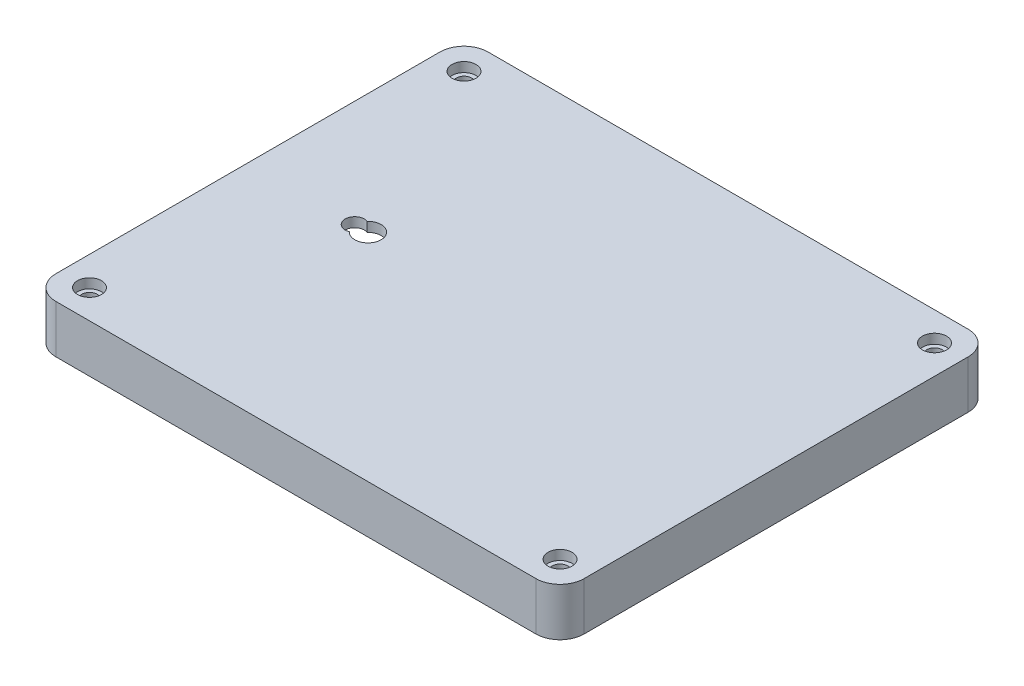
from build123d import *

# Parameters (mm, degrees)
SKETCH1_W            = 110
SKETCH1_H            = 90
BOSS_EXTRUDE1_DEPTH  = 10
SHELL2_T             = -2
FILLET3_R            = 5
FILLET4_R            = 5
SKETCH5_R            = 4
BOSS_EXTRUDE12_DEPTH = 8
FILLET5_R            = 5
FILLET6_DEPTH        = 9
FILLET7_R            = 5
FILLET8_R            = 5
FILLET9_R            = 5
FILLET10_R           = 5
FILLET11_DEPTH       = 9
FILLET12_DEPTH       = 9
SKETCH6_R            = 1.6
CUT_EXTRUDE1_DEPTH   = 10
SKETCH7_R            = 4
BOSS_EXTRUDE13_DEPTH = 10
SKETCH8_R            = 1.5
CUT_EXTRUDE2_DEPTH   = 8
SKETCH9_R            = 2.75
CUT_EXTRUDE3_DEPTH   = 10
SKETCH10_R           = 2
CUT_EXTRUDE7_DEPTH   = 10
SKETCH11_R           = 2.5
CUT_EXTRUDE8_DEPTH   = 2


with BuildPart() as part:
    # Sketch1 → Boss-Extrude1 (new body)
    with BuildSketch(Plane(origin=(0, 0, 0), x_dir=(1, 0, 0), z_dir=(0, 1, 0))):
        with Locations((55, 45)):
            Rectangle(SKETCH1_W, SKETCH1_H)
    extrude(amount=BOSS_EXTRUDE1_DEPTH)

    # Shell2
    shell2_openings = [part.faces().sort_by_distance(p)[0] for p in [
        (55, 0, -45),
    ]]
    offset(amount=SHELL2_T, openings=shell2_openings, kind=Kind.INTERSECTION)

    # Fillet3
    fillet3_edges = [part.edges().sort_by_distance(p)[0] for p in [
        (0, 5, -90),
        (110, 5, -90),
        (110, 5, 0),
        (0, 5, 0),
    ]]
    fillet(fillet3_edges, radius=FILLET3_R)

    # Fillet4
    fillet4_edges = [part.edges().sort_by_distance(p)[0] for p in [
        (2, 4, -88),
        (2, 4, -2),
        (108, 4, -2),
        (108, 4, -88),
    ]]
    fillet(fillet4_edges, radius=FILLET4_R)

    # Sketch5 → Boss-Extrude12 (add)
    with BuildSketch(Plane(origin=(0, 8, 0), x_dir=(-1, 0, 0), z_dir=(0, -1, 0))):
        with Locations((-104, 6)):
            Circle(SKETCH5_R)
        with Locations((-104, 84)):
            Circle(SKETCH5_R)
        with Locations((-6, 84)):
            Circle(SKETCH5_R)
        with Locations((-6, 6)):
            Circle(SKETCH5_R)
    extrude(amount=BOSS_EXTRUDE12_DEPTH)

    # Fillet5
    # the kernel refuses this fillet: 5 mm, written as the material it adds along each edge
    with BuildSketch(Plane(origin=(107.972048604, 0, -6.472048604), x_dir=(-0.7834590295976485, 0, -0.621443439857491), z_dir=(0, 1, 0))) as fillet5_piece_1_section:
        with BuildLine():
            CenterArc((9.160403969, -3.547792862), FILLET5_R, 134.800989095, 83.620629792)
            Line((5.243108821, -6.655010061), (4.851379306, -6.965731781))
            ThreePointArc((4.851379306, -6.965731781), (-0.085536357, -0.74172022), (-0.422348831, -0.26762187))
            Line((-0.422348831, -0.26762187), (0.35232323, 0.354779286))
            ThreePointArc((0.35232323, 0.354779286), (2.818585837, -0.661765711), (5.284848444, 0.354779286))
            Line((5.284848444, 0.354779286), (5.637171673, 0))
        make_face()
    fillet5_piece_1 = extrude(amount=29.180673535, mode=Mode.PRIVATE)
    fillet5_piece_1 = split(fillet5_piece_1, bisect_by=Plane(origin=(107.972048604, 10, -6.472048604), z_dir=(0, -1, 0)), keep=Keep.TOP, mode=Mode.PRIVATE)
    add(fillet5_piece_1)

    # Fillet6: read off the stored shape, not the designer's step
    # Fillet6 outline → Fillet6 (add)
    with BuildSketch(Plane(origin=(0, 0, 0), x_dir=(1, 0, 0), z_dir=(0, 1, 0))):
        with BuildLine():
            ThreePointArc((100.02476804, 6.444444444), (98.389061423, 3.273220038), (95.05572809, 2))
            Line((95.05572809, 2), (103, 2))
            ThreePointArc((103, 2), (103.264345398, 2.006992739), (103.527951396, 2.027951396))
            ThreePointArc((103.527951396, 2.027951396), (100.866163882, 3.51422624), (100.02476804, 6.444444444))
        make_face()
    extrude(amount=FILLET6_DEPTH)

    # Fillet7
    # the kernel refuses this fillet: 5 mm, written as the material it adds along each edge
    with BuildSketch(Plane(origin=(107.972048604, 0, -83.527951396), x_dir=(0.0032991627515109216, 0, 0.9999945577477605), z_dir=(0, 1, 0))) as fillet7_piece_1_section:
        with BuildLine():
            CenterArc((8.4557736, -4.999972789), FILLET7_R, 89.810971555, 83.620629792)
            Line((3.488593561, -4.428026585), (2.991875557, -4.370831965))
            ThreePointArc((2.991875557, -4.370831965), (2.264117061, -1.804476076), (-0.060643809, -0.496308703))
            Line((-0.060643809, -0.496308703), (-0.051154492, 0.497376334))
            ThreePointArc((-0.051154492, 0.497376334), (0.52969032, 0.526206725), (8.473918995, 0.499997279))
            Line((8.473918995, 0.499997279), (8.472269414, 0))
        make_face()
    fillet7_piece_1 = extrude(amount=29.180673535, mode=Mode.PRIVATE)
    fillet7_piece_1 = split(fillet7_piece_1, bisect_by=Plane(origin=(107.972048604, 10, -83.527951396), z_dir=(0, -1, 0)), keep=Keep.TOP, mode=Mode.PRIVATE)
    add(fillet7_piece_1)

    # Fillet8
    # the kernel refuses this fillet: 5 mm, written as the material it adds along each edge
    with BuildSketch(Plane(origin=(103.527951396, 0, -87.972048604), x_dir=(-0.6214434398574978, 0, 0.783459029597643), z_dir=(0, 1, 0))) as fillet8_piece_1_section:
        with BuildLine():
            CenterArc((9.160403969, -3.547792862), FILLET8_R, 134.800989095, 83.620629792)
            Line((5.243108821, -6.655010061), (4.851379306, -6.965731781))
            ThreePointArc((4.851379306, -6.965731781), (-0.085536357, -0.74172022), (-0.422348831, -0.26762187))
            Line((-0.422348831, -0.26762187), (0.35232323, 0.354779286))
            ThreePointArc((0.35232323, 0.354779286), (2.818585837, -0.661765711), (5.284848444, 0.354779286))
            Line((5.284848444, 0.354779286), (5.637171673, 0))
        make_face()
    fillet8_piece_1 = extrude(amount=29.180673535, mode=Mode.PRIVATE)
    fillet8_piece_1 = split(fillet8_piece_1, bisect_by=Plane(origin=(103.527951396, 10, -87.972048604), z_dir=(0, -1, 0)), keep=Keep.TOP, mode=Mode.PRIVATE)
    add(fillet8_piece_1)

    # Fillet9
    # the kernel refuses this fillet: 5 mm, written as the material it adds along each edge
    with BuildSketch(Plane(origin=(6.472048604, 29.180673535, -2.027951396), x_dir=(0.9999945577477605, 0, 0.003299162751511756), z_dir=(0, -1, 0))) as fillet9_piece_1_section:
        with BuildLine():
            CenterArc((8.4557736, -4.999972789), FILLET9_R, 89.810971555, 83.620629792)
            Line((3.488593561, -4.428026585), (2.991875557, -4.370831965))
            ThreePointArc((2.991875557, -4.370831965), (2.264117061, -1.804476076), (-0.060643809, -0.496308703))
            Line((-0.060643809, -0.496308703), (-0.051154492, 0.497376334))
            ThreePointArc((-0.051154492, 0.497376334), (0.52969032, 0.526206725), (8.473918995, 0.499997279))
            Line((8.473918995, 0.499997279), (8.472269414, 0))
        make_face()
    fillet9_piece_1 = extrude(amount=29.180673535, mode=Mode.PRIVATE)
    fillet9_piece_1 = split(fillet9_piece_1, bisect_by=Plane(origin=(6.472048604, 10, -2.027951396), z_dir=(0, -1, 0)), keep=Keep.TOP, mode=Mode.PRIVATE)
    add(fillet9_piece_1)

    # Fillet10
    # the kernel refuses this fillet: 5 mm, written as the material it adds along each edge
    with BuildSketch(Plane(origin=(2.027951396, 29.180673535, -6.472048604), x_dir=(0.783459029597646, 0, -0.6214434398574942), z_dir=(0, -1, 0))) as fillet10_piece_1_section:
        with BuildLine():
            CenterArc((9.160403969, -3.547792862), FILLET10_R, 134.800989095, 83.620629792)
            Line((5.243108821, -6.655010061), (4.851379306, -6.965731781))
            ThreePointArc((4.851379306, -6.965731781), (-0.085536357, -0.74172022), (-0.422348831, -0.26762187))
            Line((-0.422348831, -0.26762187), (0.35232323, 0.354779286))
            ThreePointArc((0.35232323, 0.354779286), (2.818585837, -0.661765711), (5.284848444, 0.354779286))
            Line((5.284848444, 0.354779286), (5.637171673, 0))
        make_face()
    fillet10_piece_1 = extrude(amount=29.180673535, mode=Mode.PRIVATE)
    fillet10_piece_1 = split(fillet10_piece_1, bisect_by=Plane(origin=(2.027951396, 10, -6.472048604), z_dir=(0, -1, 0)), keep=Keep.TOP, mode=Mode.PRIVATE)
    add(fillet10_piece_1)

    # Fillet11: read off the stored shape, not the designer's step
    # Fillet11 outline → Fillet11 (add)
    with BuildSketch(Plane(origin=(0, 0, 0), x_dir=(1, 0, 0), z_dir=(0, 1, 0))):
        with BuildLine():
            ThreePointArc((2, 75.05572809), (3.273220038, 78.389061423), (6.444444444, 80.02476804))
            ThreePointArc((6.444444444, 80.02476804), (3.51422624, 80.866163882), (2.027951396, 83.527951396))
            ThreePointArc((2.027951396, 83.527951396), (2.006992739, 83.264345398), (2, 83))
            Line((2, 83), (2, 75.05572809))
        make_face()
    extrude(amount=FILLET11_DEPTH)

    # Fillet12: read off the stored shape, not the designer's step
    # Fillet12 outline → Fillet12 (add)
    with BuildSketch(Plane(origin=(0, 0, 0), x_dir=(1, 0, 0), z_dir=(0, 1, 0))):
        with BuildLine():
            ThreePointArc((9.97523196, 83.555555556), (11.610938577, 86.726779962), (14.94427191, 88))
            Line((14.94427191, 88), (7, 88))
            ThreePointArc((7, 88), (6.735654602, 87.993007261), (6.472048604, 87.972048604))
            ThreePointArc((6.472048604, 87.972048604), (9.133836118, 86.48577376), (9.97523196, 83.555555556))
        make_face()
    extrude(amount=FILLET12_DEPTH)

    # Sketch6 → Cut-Extrude1 (cut)
    with BuildSketch(Plane(origin=(0, 0, 0), x_dir=(-1, 0, 0), z_dir=(0, -1, 0))):
        with Locations(Location((-6, 6, 0), (0, 0, 90))):
            Circle(SKETCH6_R)
        with Locations(Location((-104, 84, 0), (0, 0, 90))):
            Circle(SKETCH6_R)
        with Locations(Location((-104, 6, 0), (0, 0, 90))):
            Circle(SKETCH6_R)
        with Locations(Location((-6, 84, 0), (0, 0, 90))):
            Circle(SKETCH6_R)
    extrude(amount=-CUT_EXTRUDE1_DEPTH, mode=Mode.SUBTRACT)

    # Sketch7 → Boss-Extrude13 (add)
    with BuildSketch(Plane(origin=(0, 8, 0), x_dir=(-1, 0, 0), z_dir=(0, -1, 0))):
        with Locations(Location((-95.5, 15.7, 0), (0, 0, 90))):
            Circle(SKETCH7_R)
        with Locations(Location((-95.5, 74, 0), (0, 0, 90))):
            Circle(SKETCH7_R)
        with Locations(Location((-16, 74, 0), (0, 0, 90))):
            Circle(SKETCH7_R)
        with Locations(Location((-16, 15.7, 0), (0, 0, 90))):
            Circle(SKETCH7_R)
    extrude(amount=BOSS_EXTRUDE13_DEPTH)

    # Sketch8 → Cut-Extrude2 (cut)
    with BuildSketch(Plane(origin=(0, -2, 0), x_dir=(-1, 0, 0), z_dir=(0, -1, 0))):
        with Locations(Location((-95.5, 15.7, 0), (0, 0, 90))):
            Circle(SKETCH8_R)
        with Locations(Location((-16, 15.7, 0), (0, 0, 90))):
            Circle(SKETCH8_R)
        with Locations(Location((-16, 74, 0), (0, 0, 90))):
            Circle(SKETCH8_R)
        with Locations(Location((-95.5, 74, 0), (0, 0, 90))):
            Circle(SKETCH8_R)
    extrude(amount=-CUT_EXTRUDE2_DEPTH, mode=Mode.SUBTRACT)

    # Sketch9 → Cut-Extrude3 (cut)
    with BuildSketch(Plane(origin=(0, 10, 0), x_dir=(1, 0, 0), z_dir=(0, 1, 0))):
        with Locations(Location((25, 45, 0), (0, 0, 270))):
            Circle(SKETCH9_R)
    extrude(amount=-CUT_EXTRUDE3_DEPTH, mode=Mode.SUBTRACT)

    # Sketch10 → Cut-Extrude7 (cut)
    with BuildSketch(Plane(origin=(0, 10, 0), x_dir=(1, 0, 0), z_dir=(0, 1, 0))):
        with Locations((22.25, 45)):
            Circle(SKETCH10_R)
    extrude(amount=-CUT_EXTRUDE7_DEPTH, mode=Mode.SUBTRACT)

    # Sketch11 → Cut-Extrude8 (cut)
    with BuildSketch(Plane(origin=(0, 10, 0), x_dir=(1, 0, 0), z_dir=(0, 1, 0))):
        with Locations(Location((6, 6, 0), (0, 0, 270))):
            Circle(SKETCH11_R)
        with Locations(Location((6, 84, 0), (0, 0, 270))):
            Circle(SKETCH11_R)
        with Locations(Location((104, 84, 0), (0, 0, 270))):
            Circle(SKETCH11_R)
        with Locations(Location((104, 6, 0), (0, 0, 270))):
            Circle(SKETCH11_R)
    extrude(amount=-CUT_EXTRUDE8_DEPTH, mode=Mode.SUBTRACT)


solid = part.part
